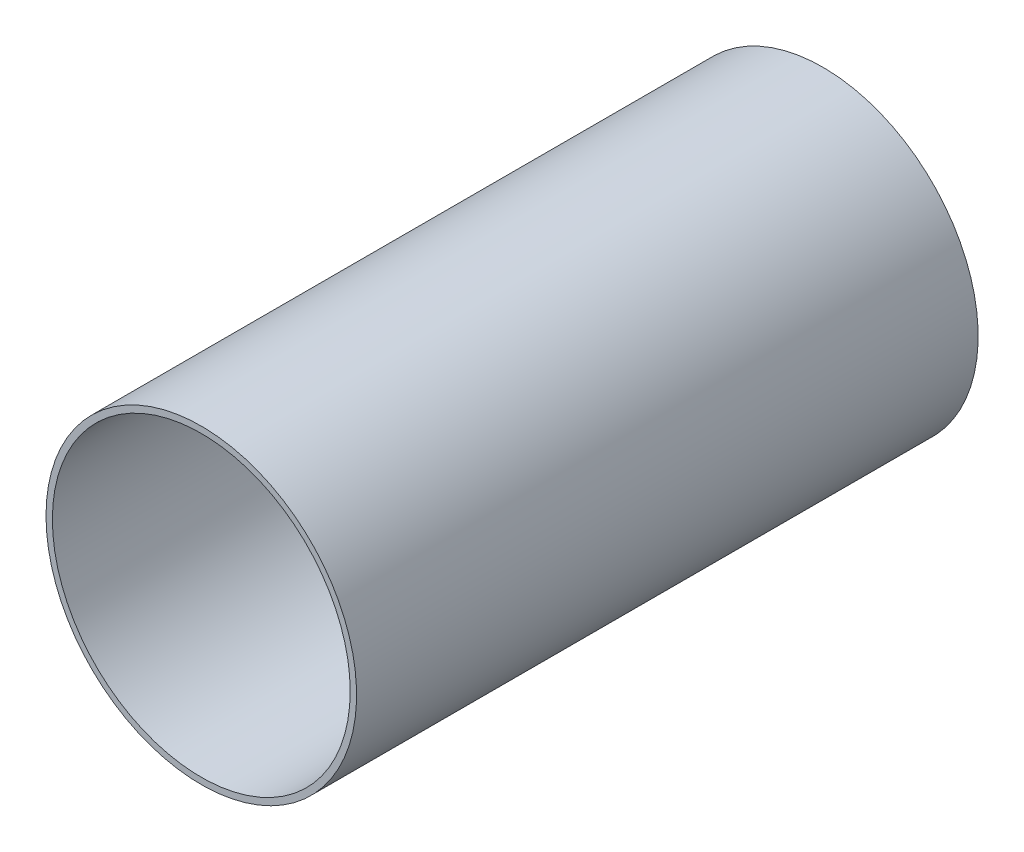
from build123d import *

# Parameters (mm, degrees)
SKETCH1_R           = 38.0746
SKETCH1_R_2         = 36.5125
BOSS_EXTRUDE1_DEPTH = 76.2


with BuildPart() as part:
    # Sketch1 → Boss-Extrude1 (new, symmetric)
    with BuildSketch(Plane.XY):
        Circle(SKETCH1_R)
        Circle(SKETCH1_R_2, mode=Mode.SUBTRACT)
    extrude(amount=BOSS_EXTRUDE1_DEPTH, both=True)


solid = part.part
